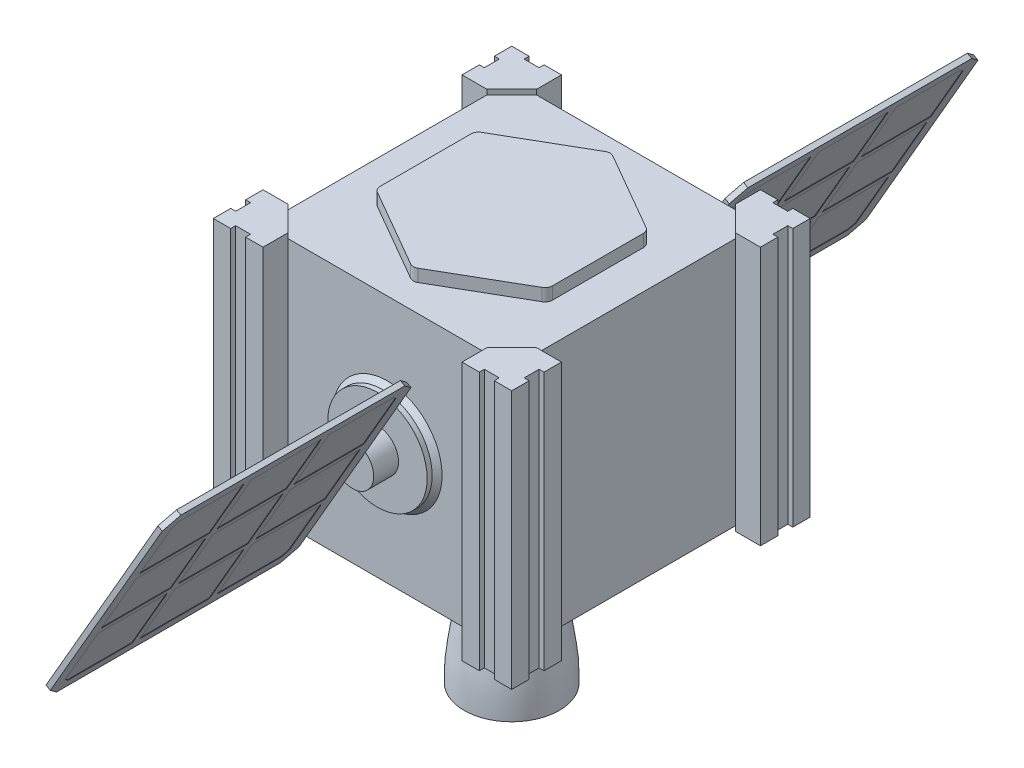
from build123d import *

# Parameters (mm, degrees)
SKETCH2_W                = 12.7
SKETCH2_H                = 12.7
BOSS_EXTRUDE1_DEPTH      = 127
BOSS_EXTRUDE2_DEPTH      = 2.54
SKETCH5_W                = 7.62
SKETCH5_H                = 2.54
SKETCH5_W_2              = 2.54
SKETCH5_H_2              = 7.62
CUT_EXTRUDE1_DEPTH       = 171.464091233
CIRPATTERN1_COUNT        = 4
SKETCH6_R                = 25.4
BOSS_EXTRUDE3_DEPTH      = 5.08
CHAMFER1_SIZE            = 2.54
SKETCH7_R                = 10.795
BOSS_EXTRUDE4_DEPTH      = 12.7
BOSS_EXTRUDE5_DEPTH      = 1.27
CHAMFER2_SIZE            = 6.35
SKETCH11_W               = 35.56
SKETCH11_H               = 35.56
CUT_EXTRUDE2_DEPTH       = 0.254
CUT_EXTRUDE4_DEPTH       = 0.254
CIRPATTERN2_COUNT        = 4
MIRROR2_COPY_1_DEPTH     = 0.254
MIRROR2_COPY_2_DEPTH     = 0.254
MIRROR2_COPY_3_DEPTH     = 0.254
MIRROR3_COPY_1_DEPTH     = 0.254
MIRROR3_COPY_2_DEPTH     = 0.254
MIRROR3_COPY_3_DEPTH     = 0.254
MIRROR3_COPY_4_SKETCH_W  = 35.56
MIRROR3_COPY_4_SKETCH_H  = 35.56
MIRROR3_COPY_4_DEPTH     = 0.254
MIRROR3_COPY_5_DEPTH     = 0.254
MIRROR3_COPY_6_DEPTH     = 0.254
MIRROR3_COPY_7_DEPTH     = 0.254
MIRROR3_COPY_8_DEPTH     = 0.254
CHAMFER2_OF_MIRROR3_SIZE = 6.35
BOSS_EXTRUDE6_DEPTH      = 6.35
FILLET1_R                = 3.81


with BuildPart() as part:
    # Sketch2 → Boss-Extrude1 (new body)
    with BuildSketch(Plane(origin=(0, 0, 0), x_dir=(1, 0, 0), z_dir=(0, 1, 0))):
        Polygon((-76.2, 50.8), (-63.5, 50.8), (-63.5, 63.5), (-50.8, 63.5), (-50.8, 76.2), (-76.2, 76.2), align=None)
        with Locations((-57.15, 57.15)):
            Rectangle(SKETCH2_W, SKETCH2_H)
        with Locations((57.15, 57.15)):
            Rectangle(SKETCH2_W, SKETCH2_H)
        Polygon((63.5, 63.5), (63.5, 50.8), (76.2, 50.8), (76.2, 76.2), (50.8, 76.2), (50.8, 63.5), align=None)
        Polygon((63.5, -50.8), (63.5, -63.5), (50.8, -63.5), (50.8, -76.2), (76.2, -76.2), (76.2, -50.8), align=None)
        Polygon((-50.8, -76.2), (-50.8, -63.5), (-63.5, -63.5), (-63.5, -50.8), (-76.2, -50.8), (-76.2, -76.2), align=None)
        with Locations((-57.15, -57.15)):
            Rectangle(SKETCH2_W, SKETCH2_H)
        Polygon((-50.8, -63.5), (50.8, -63.5), (50.8, -50.8), (63.5, -50.8), (63.5, 50.8), (50.8, 50.8), (50.8, 63.5), (-50.8, 63.5), (-50.8, 50.8), (-63.5, 50.8), (-63.5, -50.8), (-50.8, -50.8), align=None)
        with Locations((57.15, -57.15)):
            Rectangle(SKETCH2_W, SKETCH2_H)
    extrude(amount=BOSS_EXTRUDE1_DEPTH)

    # Sketch3 → Boss-Extrude2 (add)
    with BuildSketch(Plane.XZ):
        Polygon((-50.8, 63.5), (-63.5, 50.8), (-76.2, 50.8), (-76.2, 76.2), (-50.8, 76.2), align=None)
        Polygon((50.8, 63.5), (63.5, 50.8), (76.2, 50.8), (76.2, 76.2), (50.8, 76.2), align=None)
        Polygon((63.5, -50.8), (50.8, -63.5), (50.8, -76.2), (76.2, -76.2), (76.2, -50.8), align=None)
        Polygon((-50.8, -63.5), (-63.5, -50.8), (-76.2, -50.8), (-76.2, -76.2), (-50.8, -76.2), (-50.8, -65.336279166), align=None)
    boss_extrude2 = extrude(amount=BOSS_EXTRUDE2_DEPTH)

    # Mirror1: Boss-Extrude2 across plane
    add(boss_extrude2.mirror(Plane.ZX.offset(63.5)))

    # Sketch5 → Cut-Extrude1 (cut, through all)
    with BuildSketch(Plane(origin=(0, 129.54, 0), x_dir=(1, 0, 0), z_dir=(0, 1, 0))):
        with Locations((-63.5, 74.93)):
            Rectangle(SKETCH5_W, SKETCH5_H)
        with Locations((-74.93, 63.5)):
            Rectangle(SKETCH5_W_2, SKETCH5_H_2)
    cut_extrude1 = extrude(amount=-CUT_EXTRUDE1_DEPTH, mode=Mode.SUBTRACT)

    # CirPattern1: Cut-Extrude1 ×4 about axis
    cirpattern1_axis = Axis((0, 0, 0), (0, 1, 0))
    for i in range(1, CIRPATTERN1_COUNT):
        add(cut_extrude1.rotate(cirpattern1_axis, i * 360 / CIRPATTERN1_COUNT), mode=Mode.SUBTRACT)

    # Sketch6 → Boss-Extrude3 (add)
    with BuildSketch(Plane.XY.offset(63.5)):
        with Locations((0, 61.52570741)):
            Circle(SKETCH6_R)
    boss_extrude3 = extrude(amount=BOSS_EXTRUDE3_DEPTH)

    # Chamfer1
    chamfer1_edges = [part.edges().sort_by_distance(p)[0] for p in [
        (-25.4, 61.52570741, 63.5),
    ]]
    chamfer(chamfer1_edges, length=CHAMFER1_SIZE)

    # Sketch7 → Boss-Extrude4 (add)
    with BuildSketch(Plane.XY.offset(68.58)):
        with Locations((0, 61.52570741)):
            Circle(SKETCH7_R)
    boss_extrude4 = extrude(amount=BOSS_EXTRUDE4_DEPTH)

    # Sketch9 → Boss-Extrude5 (add, symmetric)
    with BuildSketch(Plane(origin=(0, 61.195265727, 81.28), x_dir=(-0.49999999999999734, -0.8660254037844402, 0), z_dir=(0.8660254037844403, -0.4999999999999974, 0))):
        Polygon((-0.286170892, 0), (-63.786170892, 0), (-63.786170892, -127), (63.213829108, -127), (63.213829108, 0), align=None)
    boss_extrude5 = extrude(amount=BOSS_EXTRUDE5_DEPTH, both=True)

    # Chamfer2
    chamfer2_edges = [part.edges().sort_by_distance(p)[0] for p in [
        (31.893085446, 116.435710129, 81.28),
        (-31.606914554, 6.450483849, 81.28),
        (-31.606914554, 6.450483849, 208.28),
        (31.893085446, 116.435710129, 208.28),
    ]]
    chamfer(chamfer2_edges, length=CHAMFER2_SIZE)

    # Sketch11 → Cut-Extrude2 (cut)
    with BuildSketch(Plane(origin=(-27.598179618, 15.933816432, 0), x_dir=(0, 0, 1), z_dir=(-0.8660254037844402, 0.4999999999999974, 0))):
        with Locations((144.78, 92.652825603)):
            Rectangle(SKETCH11_W, SKETCH11_H)
        Polygon((87.63, 71.062825603), (87.63, 64.02114428), (87.63, 42.544506926), (87.63, 35.502825603), (123.19, 35.502825603), (123.19, 71.062825603), align=None)
        with Locations((144.78, 53.282825603)):
            Rectangle(SKETCH11_W, SKETCH11_H)
        with Locations((184.15, 53.282825603)):
            Rectangle(SKETCH11_W, SKETCH11_H)
        with Locations((144.78, 13.912825603)):
            Rectangle(SKETCH11_W, SKETCH11_H)
    cut_extrude2 = extrude(amount=-CUT_EXTRUDE2_DEPTH, mode=Mode.SUBTRACT)

    # Sketch12 → Cut-Extrude4 (cut)
    with BuildSketch(Plane(origin=(-27.598179618, 15.933816432, 0), x_dir=(0, 0, 1), z_dir=(-0.8660254037844402, 0.4999999999999974, 0))):
        Polygon((123.19, 110.432825603), (90.260256121, 110.432825603), (87.63, 107.802569482), (87.63, 74.872825603), (123.19, 74.872825603), align=None)
    cut_extrude4 = extrude(amount=-CUT_EXTRUDE4_DEPTH, mode=Mode.SUBTRACT)

    # CirPattern2: Cut-Extrude4 ×4 about axis
    cirpattern2_axis = Axis((26.641412801, 46.144280557, 144.78), (-0.8660254037844403, 0.4999999999999973, 0))
    for i in range(1, CIRPATTERN2_COUNT):
        add(cut_extrude4.rotate(cirpattern2_axis, i * 360 / CIRPATTERN2_COUNT), mode=Mode.SUBTRACT)

    # Mirror2: Cut-Extrude2, Cut-Extrude4 across plane
    add(cut_extrude2.mirror(Plane(origin=(0, 61.195265727, 81.28), x_dir=(0, 0, 1), z_dir=(0.8660254037844402, -0.49999999999999734, 0))), mode=Mode.SUBTRACT)
    add(cut_extrude4.mirror(Plane(origin=(0, 61.195265727, 81.28), x_dir=(0, 0, 1), z_dir=(0.8660254037844402, -0.49999999999999734, 0))), mode=Mode.SUBTRACT)

    # Mirror2 copy 1 sketch → Mirror2 copy 1 (cut)
    with BuildSketch(Plane(origin=(-71.147062291, -64.575060971, 198.062825603), x_dir=(0.4999999999999975, 0.8660254037844402, 0), z_dir=(0.8660254037844405, -0.4999999999999976, 0))):
        Polygon((123.19, -110.432825603), (90.260256121, -110.432825603), (87.63, -107.802569482), (87.63, -74.872825603), (123.19, -74.872825603), align=None)
    extrude(amount=-MIRROR2_COPY_1_DEPTH, mode=Mode.SUBTRACT)

    # Mirror2 copy 2 sketch → Mirror2 copy 2 (cut)
    with BuildSketch(Plane(origin=(27.88435051, 106.952377546, 289.56), x_dir=(0, 0, -1), z_dir=(0.8660254037844405, -0.4999999999999977, 0))):
        Polygon((123.19, -110.432825603), (90.260256121, -110.432825603), (87.63, -107.802569482), (87.63, -74.872825603), (123.19, -74.872825603), align=None)
    extrude(amount=-MIRROR2_COPY_2_DEPTH, mode=Mode.SUBTRACT)

    # Mirror2 copy 3 sketch → Mirror2 copy 3 (cut)
    with BuildSketch(Plane(origin=(73.632937709, 186.191254949, 91.497174397), x_dir=(-0.4999999999999975, -0.8660254037844402, 0), z_dir=(0.8660254037844406, -0.49999999999999767, 0))):
        Polygon((123.19, -110.432825603), (90.260256121, -110.432825603), (87.63, -107.802569482), (87.63, -74.872825603), (123.19, -74.872825603), align=None)
    extrude(amount=-MIRROR2_COPY_3_DEPTH, mode=Mode.SUBTRACT)

    # Mirror3: Boss-Extrude3, Boss-Extrude4, Boss-Extrude5, Cut-Extrude2, Cut-Extrude4 across plane
    add(boss_extrude3.mirror(Plane.XY))
    add(boss_extrude4.mirror(Plane.XY))
    add(boss_extrude5.mirror(Plane.XY))
    add(cut_extrude2.mirror(Plane.XY), mode=Mode.SUBTRACT)
    add(cut_extrude4.mirror(Plane.XY), mode=Mode.SUBTRACT)

    # Mirror3 copy 1 sketch → Mirror3 copy 1 (cut)
    with BuildSketch(Plane(origin=(-73.346766817, -63.305060971, -198.062825603), x_dir=(0.4999999999999973, 0.8660254037844403, 0), z_dir=(-0.8660254037844403, 0.4999999999999973, 0))):
        Polygon((123.19, -110.432825603), (90.260256121, -110.432825603), (87.63, -107.802569482), (87.63, -74.872825603), (123.19, -74.872825603), align=None)
    extrude(amount=-MIRROR3_COPY_1_DEPTH, mode=Mode.SUBTRACT)

    # Mirror3 copy 2 sketch → Mirror3 copy 2 (cut)
    with BuildSketch(Plane(origin=(25.684645985, 108.222377546, -289.56), x_dir=(0, 0, 1), z_dir=(-0.8660254037844404, 0.4999999999999973, 0))):
        Polygon((123.19, -110.432825603), (90.260256121, -110.432825603), (87.63, -107.802569482), (87.63, -74.872825603), (123.19, -74.872825603), align=None)
    extrude(amount=-MIRROR3_COPY_2_DEPTH, mode=Mode.SUBTRACT)

    # Mirror3 copy 3 sketch → Mirror3 copy 3 (cut)
    with BuildSketch(Plane(origin=(71.433233183, 187.461254949, -91.497174397), x_dir=(-0.4999999999999973, -0.8660254037844403, 0), z_dir=(-0.8660254037844404, 0.49999999999999734, 0))):
        Polygon((123.19, -110.432825603), (90.260256121, -110.432825603), (87.63, -107.802569482), (87.63, -74.872825603), (123.19, -74.872825603), align=None)
    extrude(amount=-MIRROR3_COPY_3_DEPTH, mode=Mode.SUBTRACT)

    # Mirror3 copy 4 sketch → Mirror3 copy 4 (cut)
    with BuildSketch(Plane(origin=(-25.398475093, 14.663816432, 0), x_dir=(0, 0, -1), z_dir=(0.8660254037844405, -0.4999999999999975, 0))):
        with Locations((144.78, 92.652825603)):
            Rectangle(MIRROR3_COPY_4_SKETCH_W, MIRROR3_COPY_4_SKETCH_H)
        Polygon((87.63, 71.062825603), (87.63, 64.02114428), (87.63, 42.544506926), (87.63, 35.502825603), (123.19, 35.502825603), (123.19, 71.062825603), align=None)
        with Locations((144.78, 53.282825603)):
            Rectangle(MIRROR3_COPY_4_SKETCH_W, MIRROR3_COPY_4_SKETCH_H)
        with Locations((184.15, 53.282825603)):
            Rectangle(MIRROR3_COPY_4_SKETCH_W, MIRROR3_COPY_4_SKETCH_H)
        with Locations((144.78, 13.912825603)):
            Rectangle(MIRROR3_COPY_4_SKETCH_W, MIRROR3_COPY_4_SKETCH_H)
    extrude(amount=-MIRROR3_COPY_4_DEPTH, mode=Mode.SUBTRACT)

    # Mirror3 copy 5 sketch → Mirror3 copy 5 (cut)
    with BuildSketch(Plane(origin=(-25.398475093, 14.663816432, 0), x_dir=(0, 0, -1), z_dir=(0.8660254037844405, -0.4999999999999975, 0))):
        Polygon((123.19, 110.432825603), (90.260256121, 110.432825603), (87.63, 107.802569482), (87.63, 74.872825603), (123.19, 74.872825603), align=None)
    extrude(amount=-MIRROR3_COPY_5_DEPTH, mode=Mode.SUBTRACT)

    # Mirror3 copy 6 sketch → Mirror3 copy 6 (cut)
    with BuildSketch(Plane(origin=(-71.147062291, -64.575060971, -198.062825603), x_dir=(0.4999999999999975, 0.8660254037844402, 0), z_dir=(0.8660254037844405, -0.4999999999999976, 0))):
        Polygon((123.19, 110.432825603), (90.260256121, 110.432825603), (87.63, 107.802569482), (87.63, 74.872825603), (123.19, 74.872825603), align=None)
    extrude(amount=-MIRROR3_COPY_6_DEPTH, mode=Mode.SUBTRACT)

    # Mirror3 copy 7 sketch → Mirror3 copy 7 (cut)
    with BuildSketch(Plane(origin=(27.88435051, 106.952377546, -289.56), x_dir=(0, 0, 1), z_dir=(0.8660254037844405, -0.4999999999999977, 0))):
        Polygon((123.19, 110.432825603), (90.260256121, 110.432825603), (87.63, 107.802569482), (87.63, 74.872825603), (123.19, 74.872825603), align=None)
    extrude(amount=-MIRROR3_COPY_7_DEPTH, mode=Mode.SUBTRACT)

    # Mirror3 copy 8 sketch → Mirror3 copy 8 (cut)
    with BuildSketch(Plane(origin=(73.632937709, 186.191254949, -91.497174397), x_dir=(-0.4999999999999975, -0.8660254037844402, 0), z_dir=(0.8660254037844406, -0.49999999999999767, 0))):
        Polygon((123.19, 110.432825603), (90.260256121, 110.432825603), (87.63, 107.802569482), (87.63, 74.872825603), (123.19, 74.872825603), align=None)
    extrude(amount=-MIRROR3_COPY_8_DEPTH, mode=Mode.SUBTRACT)

    # Chamfer2 of Mirror3
    chamfer2_of_mirror3_edges = [part.edges().sort_by_distance(p)[0] for p in [
        (31.893085446, 116.435710129, -81.28),
        (-31.606914554, 6.450483849, -81.28),
        (-31.606914554, 6.450483849, -208.28),
        (31.893085446, 116.435710129, -208.28),
    ]]
    chamfer(chamfer2_of_mirror3_edges, length=CHAMFER2_OF_MIRROR3_SIZE)

    # Sketch13 → Revolve2 (revolve)
    with BuildSketch(Plane(origin=(0, 0, 0), x_dir=(0, 0, -1), z_dir=(1, 0, 0))):
        with BuildLine():
            Line((24.338564391, -75.859054765), (17.988564419, -75.859649729))
            add(Edge.make_bspline(
                [(5.59826968, 0), (5.276016878, -2.961641043), (6.218182853, -7.717327254), (8.104034419, -13.869639505), (8.590116567, -18.768151255), (10.529041649, -23.758532409), (11.223572269, -29.233347909), (12.68662185, -34.808096792), (13.910610434, -40.512477461), (15.200720496, -46.587666789), (16.235202351, -54.911316173), (17.797882792, -63.219994105), (18.011162303, -70.812853484), (17.988440984, -74.542236626), (17.988564419, -75.859649729)],
                knots=[0, 0, 0, 0, 0.11444987, 0.186777058, 0.250223027, 0.304458101, 0.393661063, 0.463684812, 0.528613851, 0.620645016, 0.705117684, 0.854855235, 0.948746938, 1, 1, 1, 1], degree=3))
            Line((5.59826968, 0), (11.985749071, 0))
            add(Edge.make_bspline(
                [(11.985749071, 0), (11.982750152, -0.027561345), (11.973152879, -0.115765002), (11.951543202, -0.314365303), (11.931064806, -0.502736525), (11.911047928, -0.68639993), (11.905008701, -0.742786915), (11.893566208, -0.859073449), (11.880622411, -1.018002051), (11.856744057, -1.412622239), (11.850891483, -2.025465182), (11.906637905, -2.90565313), (12.025931538, -3.849784979), (12.267118083, -5.196763442), (12.705430082, -7.020536648), (13.291218807, -9.086592344), (13.781857266, -10.953380491), (14.13525056, -12.469700447), (14.424107889, -14.071836517), (14.626888492, -15.410310117), (14.781917635, -16.352950481), (14.909265322, -16.995347939), (15.00322942, -17.404182361), (15.114333612, -17.814827264), (15.311140956, -18.468208273), (15.631260776, -19.435337752), (16.018810442, -20.622632822), (16.326727904, -21.713040503), (16.722265278, -23.282815547), (17.145632065, -25.487184024), (17.504374721, -27.604236102), (17.804414492, -29.074150287), (18.16246467, -30.641299953), (18.686563365, -32.736754098), (19.322041077, -35.4674567), (19.880431925, -38.071166951), (20.43331146, -40.656982814), (20.978103186, -43.334471593), (21.477291762, -46.126997991), (21.876953453, -48.866374552), (22.229778542, -51.461809161), (22.725167662, -54.762290927), (23.30908199, -58.284722225), (23.810296571, -61.968668569), (24.197377829, -65.829322436), (24.330046182, -69.601854921), (24.345874224, -73.257506679), (24.338482344, -74.983374826), (24.338564391, -75.859054765)],
                knots=[-0.008847974, -0.008847974, -0.008847974, -0.008847974, -0.007782892, -0.005437985, -0.001177654, -0.000112572, 0.000952511, 0.003082676, 0.007343007, 0.011603337, 0.028644659, 0.045685981, 0.062727302, 0.079768624, 0.113851268, 0.147933911, 0.164975233, 0.182016555, 0.199057877, 0.216099198, 0.23314052, 0.241661181, 0.250181842, 0.258702503, 0.267223164, 0.284264485, 0.301305807, 0.309826468, 0.318347129, 0.352429773, 0.386512416, 0.403553738, 0.42059506, 0.454677703, 0.488760347, 0.52284299, 0.556925634, 0.591008277, 0.625090921, 0.659173564, 0.693256208, 0.727338852, 0.795504139, 0.829586782, 0.863669426, 0.931834713, 0.965917356, 1, 1, 1, 1], degree=3))
        make_face()
    revolve(axis=Axis((0, 0, 0), (0, -1, 0)))

    # Chamfer3: read off the stored shape, not the designer's step
    # Chamfer3 outline → Chamfer3 (revolve)
    with BuildSketch(Plane.XY):
        Polygon((12.440758669, 0), (12.440758669, -5.894990402), (18.335749071, 0), align=None)
    revolve(axis=Axis((0, 0, 0), (0, 1, 0)))

    # Chamfer3 2 outline → Chamfer3 2 (revolve)
    with BuildSketch(Plane.XY):
        with BuildLine():
            Line((11.985749071, -3.510131165), (11.985749071, 0))
            add(Edge.make_bspline(
                [(11.985749071, 0), (11.982750152, -0.027561345), (11.973152879, -0.115765002), (11.951543202, -0.314365303), (11.931064806, -0.502736525), (11.911047928, -0.68639993), (11.905008701, -0.742786915), (11.893566208, -0.859073449), (11.880622411, -1.018002051), (11.856744057, -1.412622239), (11.850891483, -2.025465182), (11.899886909, -2.799060727), (11.958671573, -3.307808775), (11.985749071, -3.510131165)],
                knots=[-0.008847974, -0.008847974, -0.008847974, -0.008847974, -0.007782892, -0.005437985, -0.001177654, -0.000112572, 0.000952511, 0.003082676, 0.007343007, 0.011603337, 0.028644659, 0.045685981, 0.056536095, 0.056536095, 0.056536095, 0.056536095], degree=3))
        make_face()
        with BuildLine():
            Line((12.440758669, 0), (11.985749071, 0))
            Line((11.985749071, 0), (11.985749071, -3.510131165))
            add(Edge.make_bspline(
                [(11.985749071, -3.510131165), (12.001199822, -3.625578791), (12.064322069, -4.064188391), (12.204512912, -4.847126126), (12.357901729, -5.543653176), (12.440758669, -5.894990402)],
                knots=[0.056536095, 0.056536095, 0.056536095, 0.056536095, 0.062727302, 0.079768624, 0.096157497, 0.096157497, 0.096157497, 0.096157497], degree=3))
            Line((12.440758669, -5.894990402), (12.440758669, 0))
        make_face()
    revolve(axis=Axis((0, 0, 0), (0, 1, 0)))

    # Sketch14 → Boss-Extrude6 (add)
    with BuildSketch(Plane(origin=(0, 127, 0), x_dir=(1, 0, 0), z_dir=(0, 1, 0))):
        Polygon((43.994090512, 25.4), (0, 50.8), (-43.994090512, 25.4), (-43.994090512, -25.4), (0, -50.8), (43.994090512, -25.4), align=None)
    extrude(amount=BOSS_EXTRUDE6_DEPTH)

    # Fillet1
    fillet1_edges = [part.edges().sort_by_distance(p)[0] for p in [
        (43.994090512, 130.175, 25.4),
        (43.994090512, 130.175, -25.4),
        (0, 130.175, -50.8),
        (-43.994090512, 130.175, -25.4),
        (-43.994090512, 130.175, 25.4),
        (0, 130.175, 50.8),
    ]]
    fillet(fillet1_edges, radius=FILLET1_R)


solid = part.part
